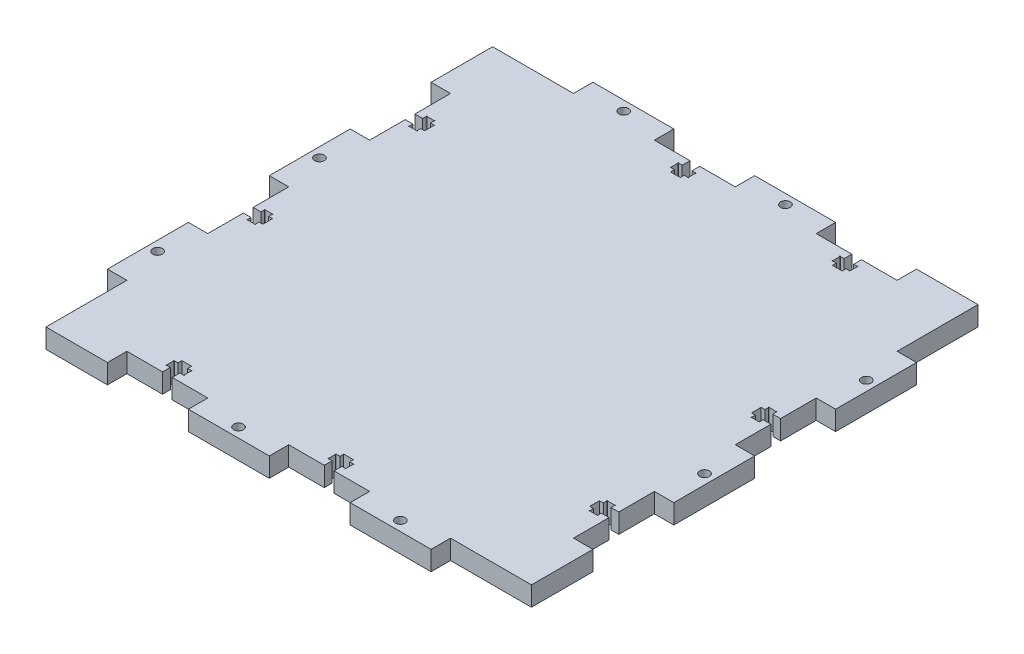
from build123d import *

# Parameters (mm, degrees)
BOSS_EXTRUDE1_DEPTH = 6
SKETCH2_R           = 1.5
CUT_EXTRUDE1_DEPTH  = 107.235587258


with BuildPart() as part:
    # Sketch1 → Boss-Extrude1 (new body)
    with BuildSketch(Plane(origin=(0, 0, 0), x_dir=(1, 0, 0), z_dir=(0, 1, 0))):
        Polygon((0, 75), (25, 75), (25, 69), (50, 69), (50, 75), (69, 75), (69, 50), (75, 50), (75, 25), (69, 25), (69, 0), (75, 0), (75, -25), (69, -25), (69, -50), (75, -50), (75, -69), (50, -69), (50, -75), (25, -75), (25, -69), (0, -69), (0, -75), (-25, -75), (-25, -69), (-50, -69), (-50, -75), (-69, -75), (-69, -50), (-75, -50), (-75, -25), (-69, -25), (-69, 0), (-75, 0), (-75, 25), (-69, 25), (-69, 50), (-75, 50), (-75, 69), (-50, 69), (-50, 75), (-25, 75), (-25, 69), (0, 69), align=None)
    extrude(amount=BOSS_EXTRUDE1_DEPTH)

    # Sketch2 → Cut-Extrude1 (cut, through all)
    with BuildSketch(Plane(origin=(0, 6, 0), x_dir=(1, 0, 0), z_dir=(0, 1, 0))):
        with Locations((-37.5, 72)):
            Circle(SKETCH2_R)
        with Locations((12.5, 72)):
            Circle(SKETCH2_R)
        with Locations((72, 37.5)):
            Circle(SKETCH2_R)
        with Locations((72, -12.5)):
            Circle(SKETCH2_R)
        with Locations((37.5, -72)):
            Circle(SKETCH2_R)
        with Locations((-12.5, -72)):
            Circle(SKETCH2_R)
        with Locations((-72, -37.5)):
            Circle(SKETCH2_R)
        with Locations((-72, 12.5)):
            Circle(SKETCH2_R)
        with BuildLine():
            Line((-11, 69), (-14, 69))
            Line((-14, 69), (-14, 66.6))
            Line((-14, 66.6), (-15.1, 66.6))
            ThreePointArc((-15.1, 66.6), (-15.270710678, 66.670710678), (-15.2, 66.5))
            Line((-15.2, 66.5), (-15.2, 64.3))
            ThreePointArc((-15.2, 64.3), (-15.270710678, 64.129289322), (-15.1, 64.2))
            Line((-15.1, 64.2), (-14, 64.2))
            Line((-14, 64.2), (-14, 63))
            Line((-14, 63), (-11, 63))
            Line((-11, 63), (-11, 64.2))
            Line((-11, 64.2), (-9.9, 64.2))
            ThreePointArc((-9.9, 64.2), (-9.729289322, 64.129289322), (-9.8, 64.3))
            Line((-9.8, 64.3), (-9.8, 66.5))
            ThreePointArc((-9.8, 66.5), (-9.729289322, 66.670710678), (-9.9, 66.6))
            Line((-9.9, 66.6), (-11, 66.6))
            Line((-11, 66.6), (-11, 69))
        make_face()
        with BuildLine():
            Line((69, 11), (69, 14))
            Line((69, 14), (66.6, 14))
            Line((66.6, 14), (66.6, 15.1))
            ThreePointArc((66.6, 15.1), (66.670710678, 15.270710678), (66.5, 15.2))
            Line((66.5, 15.2), (64.3, 15.2))
            ThreePointArc((64.3, 15.2), (64.129289322, 15.270710678), (64.2, 15.1))
            Line((64.2, 15.1), (64.2, 14))
            Line((64.2, 14), (63, 14))
            Line((63, 14), (63, 11))
            Line((63, 11), (64.2, 11))
            Line((64.2, 11), (64.2, 9.9))
            ThreePointArc((64.2, 9.9), (64.129289322, 9.729289322), (64.3, 9.8))
            Line((64.3, 9.8), (66.5, 9.8))
            ThreePointArc((66.5, 9.8), (66.670710678, 9.729289322), (66.6, 9.9))
            Line((66.6, 9.9), (66.6, 11))
            Line((66.6, 11), (69, 11))
        make_face()
        with BuildLine():
            Line((39, 69), (36, 69))
            Line((36, 69), (36, 66.6))
            Line((36, 66.6), (34.9, 66.6))
            ThreePointArc((34.9, 66.6), (34.729289322, 66.670710678), (34.8, 66.5))
            Line((34.8, 66.5), (34.8, 64.3))
            ThreePointArc((34.8, 64.3), (34.729289322, 64.129289322), (34.9, 64.2))
            Line((34.9, 64.2), (36, 64.2))
            Line((36, 64.2), (36, 63))
            Line((36, 63), (39, 63))
            Line((39, 63), (39, 64.2))
            Line((39, 64.2), (40.1, 64.2))
            ThreePointArc((40.1, 64.2), (40.270710678, 64.129289322), (40.2, 64.3))
            Line((40.2, 64.3), (40.2, 66.5))
            ThreePointArc((40.2, 66.5), (40.270710678, 66.670710678), (40.1, 66.6))
            Line((40.1, 66.6), (39, 66.6))
            Line((39, 66.6), (39, 69))
        make_face()
        with BuildLine():
            Line((69, -39), (69, -36))
            Line((69, -36), (66.6, -36))
            Line((66.6, -36), (66.6, -34.9))
            ThreePointArc((66.6, -34.9), (66.670710678, -34.729289322), (66.5, -34.8))
            Line((66.5, -34.8), (64.3, -34.8))
            ThreePointArc((64.3, -34.8), (64.129289322, -34.729289322), (64.2, -34.9))
            Line((64.2, -34.9), (64.2, -36))
            Line((64.2, -36), (63, -36))
            Line((63, -36), (63, -39))
            Line((63, -39), (64.2, -39))
            Line((64.2, -39), (64.2, -40.1))
            ThreePointArc((64.2, -40.1), (64.129289322, -40.270710678), (64.3, -40.2))
            Line((64.3, -40.2), (66.5, -40.2))
            ThreePointArc((66.5, -40.2), (66.670710678, -40.270710678), (66.6, -40.1))
            Line((66.6, -40.1), (66.6, -39))
            Line((66.6, -39), (69, -39))
        make_face()
        with BuildLine():
            Line((11, -69), (14, -69))
            Line((14, -69), (14, -66.6))
            Line((14, -66.6), (15.1, -66.6))
            ThreePointArc((15.1, -66.6), (15.270710678, -66.670710678), (15.2, -66.5))
            Line((15.2, -66.5), (15.2, -64.3))
            ThreePointArc((15.2, -64.3), (15.270710678, -64.129289322), (15.1, -64.2))
            Line((15.1, -64.2), (14, -64.2))
            Line((14, -64.2), (14, -63))
            Line((14, -63), (11, -63))
            Line((11, -63), (11, -64.2))
            Line((11, -64.2), (9.9, -64.2))
            ThreePointArc((9.9, -64.2), (9.729289322, -64.129289322), (9.8, -64.3))
            Line((9.8, -64.3), (9.8, -66.5))
            ThreePointArc((9.8, -66.5), (9.729289322, -66.670710678), (9.9, -66.6))
            Line((9.9, -66.6), (11, -66.6))
            Line((11, -66.6), (11, -69))
        make_face()
        with BuildLine():
            Line((-39, -69), (-36, -69))
            Line((-36, -69), (-36, -66.6))
            Line((-36, -66.6), (-34.9, -66.6))
            ThreePointArc((-34.9, -66.6), (-34.729289322, -66.670710678), (-34.8, -66.5))
            Line((-34.8, -66.5), (-34.8, -64.3))
            ThreePointArc((-34.8, -64.3), (-34.729289322, -64.129289322), (-34.9, -64.2))
            Line((-34.9, -64.2), (-36, -64.2))
            Line((-36, -64.2), (-36, -63))
            Line((-36, -63), (-39, -63))
            Line((-39, -63), (-39, -64.2))
            Line((-39, -64.2), (-40.1, -64.2))
            ThreePointArc((-40.1, -64.2), (-40.270710678, -64.129289322), (-40.2, -64.3))
            Line((-40.2, -64.3), (-40.2, -66.5))
            ThreePointArc((-40.2, -66.5), (-40.270710678, -66.670710678), (-40.1, -66.6))
            Line((-40.1, -66.6), (-39, -66.6))
            Line((-39, -66.6), (-39, -69))
        make_face()
        with BuildLine():
            Line((-69, 39), (-69, 36))
            Line((-69, 36), (-66.6, 36))
            Line((-66.6, 36), (-66.6, 34.9))
            ThreePointArc((-66.6, 34.9), (-66.670710678, 34.729289322), (-66.5, 34.8))
            Line((-66.5, 34.8), (-64.3, 34.8))
            ThreePointArc((-64.3, 34.8), (-64.129289322, 34.729289322), (-64.2, 34.9))
            Line((-64.2, 34.9), (-64.2, 36))
            Line((-64.2, 36), (-63, 36))
            Line((-63, 36), (-63, 39))
            Line((-63, 39), (-64.2, 39))
            Line((-64.2, 39), (-64.2, 40.1))
            ThreePointArc((-64.2, 40.1), (-64.129289322, 40.270710678), (-64.3, 40.2))
            Line((-64.3, 40.2), (-66.5, 40.2))
            ThreePointArc((-66.5, 40.2), (-66.670710678, 40.270710678), (-66.6, 40.1))
            Line((-66.6, 40.1), (-66.6, 39))
            Line((-66.6, 39), (-69, 39))
        make_face()
        with BuildLine():
            Line((-69, -11), (-69, -14))
            Line((-69, -14), (-66.6, -14))
            Line((-66.6, -14), (-66.6, -15.1))
            ThreePointArc((-66.6, -15.1), (-66.670710678, -15.270710678), (-66.5, -15.2))
            Line((-66.5, -15.2), (-64.3, -15.2))
            ThreePointArc((-64.3, -15.2), (-64.129289322, -15.270710678), (-64.2, -15.1))
            Line((-64.2, -15.1), (-64.2, -14))
            Line((-64.2, -14), (-63, -14))
            Line((-63, -14), (-63, -11))
            Line((-63, -11), (-64.2, -11))
            Line((-64.2, -11), (-64.2, -9.9))
            ThreePointArc((-64.2, -9.9), (-64.129289322, -9.729289322), (-64.3, -9.8))
            Line((-64.3, -9.8), (-66.5, -9.8))
            ThreePointArc((-66.5, -9.8), (-66.670710678, -9.729289322), (-66.6, -9.9))
            Line((-66.6, -9.9), (-66.6, -11))
            Line((-66.6, -11), (-69, -11))
        make_face()
    extrude(amount=-CUT_EXTRUDE1_DEPTH, mode=Mode.SUBTRACT)


solid = part.part
